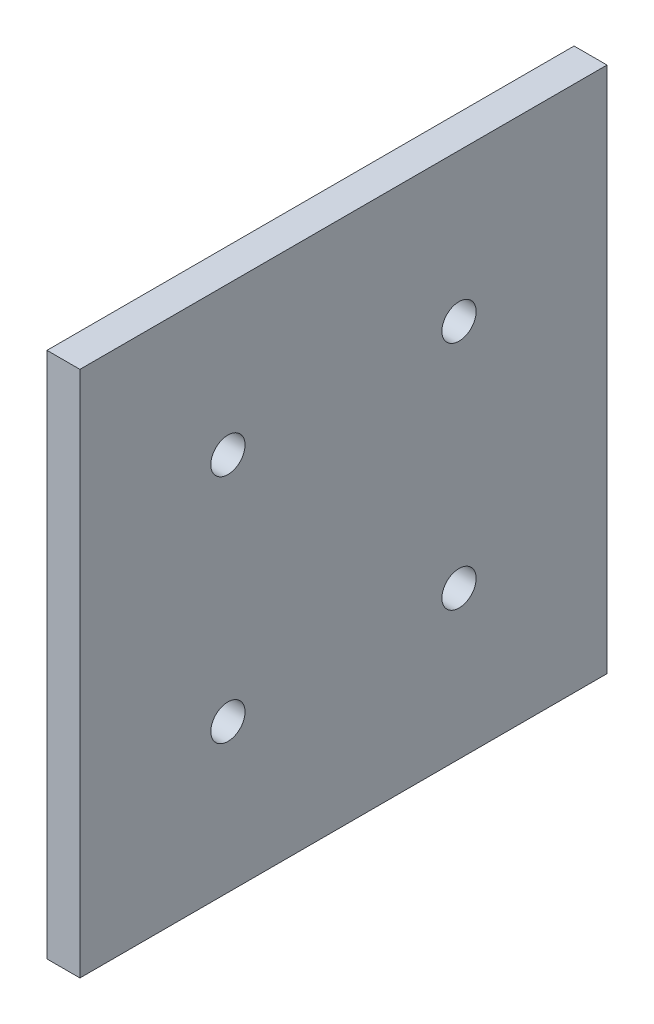
from build123d import *

# Parameters (mm, degrees)
SKETCH1_W             = 50.8
SKETCH1_H             = 50.8
BOSS_EXTRUDE1_DEPTH   = 3.175
M4X0_7_TAPPED_HOLE1_D = 3.3


with BuildPart() as part:
    # Sketch1 → Boss-Extrude1 (new body)
    with BuildSketch(Plane(origin=(0, 0, 0), x_dir=(0, 0, -1), z_dir=(1, 0, 0))):
        Rectangle(SKETCH1_W, SKETCH1_H)
    extrude(amount=BOSS_EXTRUDE1_DEPTH)

    # M4x0.7 Tapped Hole1 (through all)
    with Locations(Plane(origin=(3.175, 0, 0), x_dir=(0, 0, -1), z_dir=(1, 0, 0))):
        with Locations((11.136931804, 11.136931804), (-11.136931804, 11.136931804), (-11.136931804, -11.136931804), (11.136931804, -11.136931804)):
            Hole(M4X0_7_TAPPED_HOLE1_D / 2)


solid = part.part
